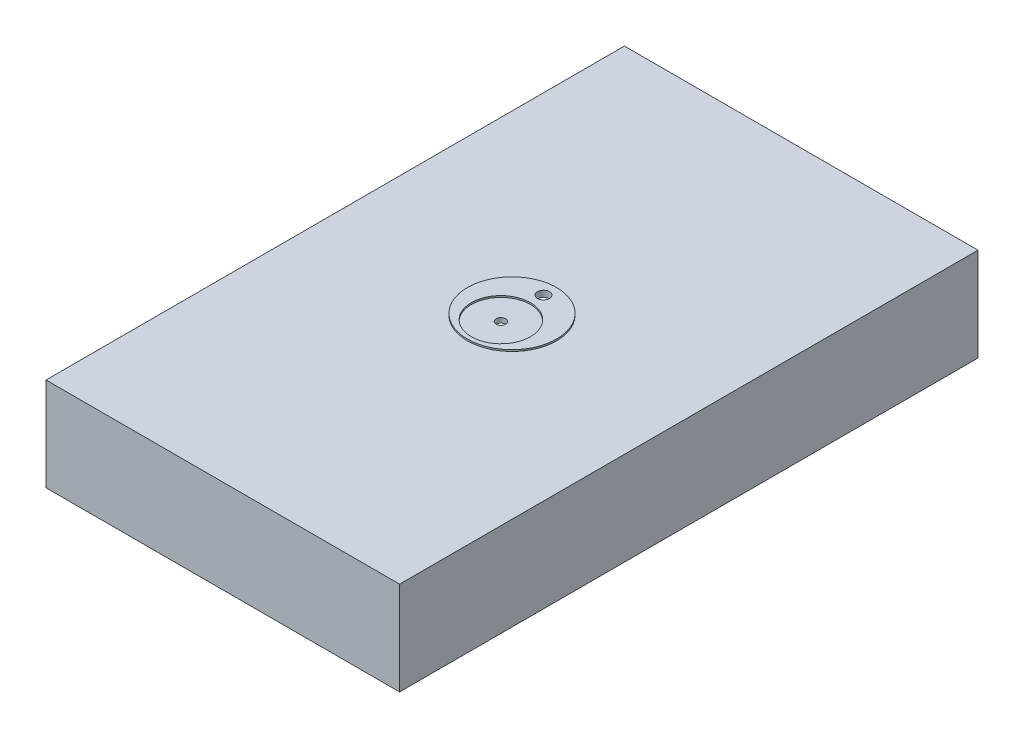
from build123d import *

# Parameters (mm, degrees)
SKETCH1_R           = 28.1
BOSS_EXTRUDE1_DEPTH = 1
SKETCH2_R           = 18.6
CUT_EXTRUDE1_DEPTH  = 58.8
SKETCH3_W           = 222.683092022
SKETCH3_H           = 364.2827524
BOSS_EXTRUDE2_DEPTH = 58.8
SKETCH4_W           = 207.917403516
SKETCH4_H           = 348.54429772
CUT_EXTRUDE2_DEPTH  = 55.8
SKETCH9_R           = 3
CUT_EXTRUDE8_DEPTH  = 10
SKETCH10_R          = 3.75
CUT_EXTRUDE9_DEPTH  = 10


with BuildPart() as part:
    # Sketch1 → Boss-Extrude1 (new body)
    with BuildSketch(Plane(origin=(0, 0, 0), x_dir=(1, 0, 0), z_dir=(0, 1, 0))):
        Circle(SKETCH1_R)
    extrude(amount=BOSS_EXTRUDE1_DEPTH)

    # Sketch2 → Cut-Extrude1 (cut)
    with BuildSketch(Plane(origin=(0, 1, 0), x_dir=(1, 0, 0), z_dir=(0, 1, 0))):
        with Locations((0, -7)):
            Circle(SKETCH2_R)
    extrude(amount=-CUT_EXTRUDE1_DEPTH, mode=Mode.SUBTRACT)

    # Sketch3 → Boss-Extrude2 (add)
    with BuildSketch(Plane(origin=(0, 0, 0), x_dir=(-1, 0, 0), z_dir=(0, -1, 0))):
        Rectangle(SKETCH3_W, SKETCH3_H)
    extrude(amount=BOSS_EXTRUDE2_DEPTH)

    # Sketch4 → Cut-Extrude2 (cut)
    with BuildSketch(Plane(origin=(0, -58.8, 0), x_dir=(-1, 0, 0), z_dir=(0, -1, 0))):
        Rectangle(SKETCH4_W, SKETCH4_H)
    extrude(amount=-CUT_EXTRUDE2_DEPTH, mode=Mode.SUBTRACT)

    # Sketch9 → Cut-Extrude8 (cut)
    with BuildSketch(Plane(origin=(0, 0, 0), x_dir=(1, 0, 0), z_dir=(0, 1, 0))):
        with Locations((0, -7)):
            Circle(SKETCH9_R)
    extrude(amount=-CUT_EXTRUDE8_DEPTH, mode=Mode.SUBTRACT)

    # Sketch10 → Cut-Extrude9 (cut)
    with BuildSketch(Plane(origin=(0, 1, 0), x_dir=(1, 0, 0), z_dir=(0, 1, 0))):
        with Locations((0, 19.85)):
            Circle(SKETCH10_R)
    extrude(amount=-CUT_EXTRUDE9_DEPTH, mode=Mode.SUBTRACT)


solid = part.part
